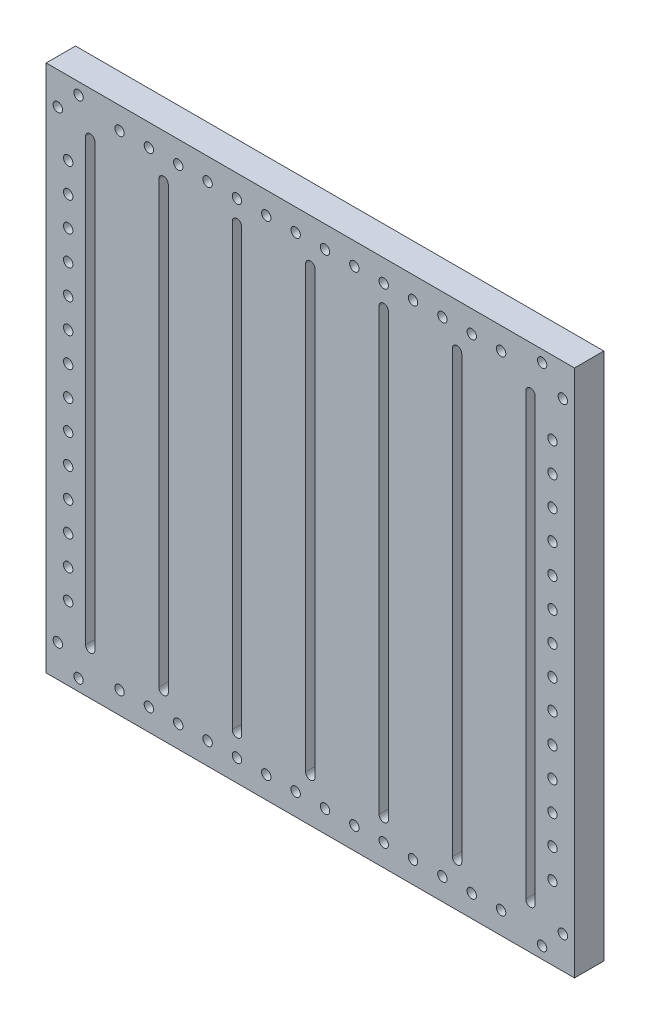
from build123d import *

# Parameters (mm, degrees)
SKETCH1_W           = 180
SKETCH1_H           = 180
SKETCH1_R           = 1.6
BOSS_EXTRUDE1_DEPTH = 10


with BuildPart() as part:
    # Sketch1 → Boss-Extrude1 (new body)
    with BuildSketch(Plane.XY):
        Rectangle(SKETCH1_W, SKETCH1_H)
        with Locations((-78.964466094, 86.035533906)):
            Circle(SKETCH1_R, mode=Mode.SUBTRACT)
        with Locations((-86.035533906, 78.964466094)):
            Circle(SKETCH1_R, mode=Mode.SUBTRACT)
        with Locations((78.964466094, 86.035533906)):
            Circle(SKETCH1_R, mode=Mode.SUBTRACT)
        with Locations((86.035533906, 78.964466094)):
            Circle(SKETCH1_R, mode=Mode.SUBTRACT)
        with Locations((86.035533906, -78.964466094)):
            Circle(SKETCH1_R, mode=Mode.SUBTRACT)
        with Locations((78.964466094, -86.035533906)):
            Circle(SKETCH1_R, mode=Mode.SUBTRACT)
        with Locations((-78.964466094, -86.035533906)):
            Circle(SKETCH1_R, mode=Mode.SUBTRACT)
        with Locations((-86.035533906, -78.964466094)):
            Circle(SKETCH1_R, mode=Mode.SUBTRACT)
        with Locations((-5, 82.5)):
            Circle(SKETCH1_R, mode=Mode.SUBTRACT)
        with Locations((5, 82.5)):
            Circle(SKETCH1_R, mode=Mode.SUBTRACT)
        with Locations((-15, 82.5)):
            Circle(SKETCH1_R, mode=Mode.SUBTRACT)
        with Locations((-25, 82.5)):
            Circle(SKETCH1_R, mode=Mode.SUBTRACT)
        with Locations((-35, 82.5)):
            Circle(SKETCH1_R, mode=Mode.SUBTRACT)
        with Locations((-45, 82.5)):
            Circle(SKETCH1_R, mode=Mode.SUBTRACT)
        with Locations((-55, 82.5)):
            Circle(SKETCH1_R, mode=Mode.SUBTRACT)
        with Locations((-65, 82.5)):
            Circle(SKETCH1_R, mode=Mode.SUBTRACT)
        with Locations((15, 82.5)):
            Circle(SKETCH1_R, mode=Mode.SUBTRACT)
        with Locations((25, 82.5)):
            Circle(SKETCH1_R, mode=Mode.SUBTRACT)
        with Locations((35, 82.5)):
            Circle(SKETCH1_R, mode=Mode.SUBTRACT)
        with Locations((45, 82.5)):
            Circle(SKETCH1_R, mode=Mode.SUBTRACT)
        with Locations((55, 82.5)):
            Circle(SKETCH1_R, mode=Mode.SUBTRACT)
        with Locations((65, 82.5)):
            Circle(SKETCH1_R, mode=Mode.SUBTRACT)
        with Locations((82.5, 65)):
            Circle(SKETCH1_R, mode=Mode.SUBTRACT)
        with Locations((82.5, 55)):
            Circle(SKETCH1_R, mode=Mode.SUBTRACT)
        with Locations((82.5, 45)):
            Circle(SKETCH1_R, mode=Mode.SUBTRACT)
        with Locations((82.5, 35)):
            Circle(SKETCH1_R, mode=Mode.SUBTRACT)
        with Locations((82.5, 25)):
            Circle(SKETCH1_R, mode=Mode.SUBTRACT)
        with Locations((82.5, 15)):
            Circle(SKETCH1_R, mode=Mode.SUBTRACT)
        with Locations((82.5, 5)):
            Circle(SKETCH1_R, mode=Mode.SUBTRACT)
        with Locations((82.5, -5)):
            Circle(SKETCH1_R, mode=Mode.SUBTRACT)
        with Locations((82.5, -15)):
            Circle(SKETCH1_R, mode=Mode.SUBTRACT)
        with Locations((82.5, -25)):
            Circle(SKETCH1_R, mode=Mode.SUBTRACT)
        with Locations((82.5, -35)):
            Circle(SKETCH1_R, mode=Mode.SUBTRACT)
        with Locations((82.5, -45)):
            Circle(SKETCH1_R, mode=Mode.SUBTRACT)
        with Locations((82.5, -55)):
            Circle(SKETCH1_R, mode=Mode.SUBTRACT)
        with Locations((82.5, -65)):
            Circle(SKETCH1_R, mode=Mode.SUBTRACT)
        with Locations((65, -82.5)):
            Circle(SKETCH1_R, mode=Mode.SUBTRACT)
        with Locations((55, -82.5)):
            Circle(SKETCH1_R, mode=Mode.SUBTRACT)
        with Locations((45, -82.5)):
            Circle(SKETCH1_R, mode=Mode.SUBTRACT)
        with Locations((35, -82.5)):
            Circle(SKETCH1_R, mode=Mode.SUBTRACT)
        with Locations((25, -82.5)):
            Circle(SKETCH1_R, mode=Mode.SUBTRACT)
        with Locations((15, -82.5)):
            Circle(SKETCH1_R, mode=Mode.SUBTRACT)
        with Locations((5, -82.5)):
            Circle(SKETCH1_R, mode=Mode.SUBTRACT)
        with Locations((-5, -82.5)):
            Circle(SKETCH1_R, mode=Mode.SUBTRACT)
        with Locations((-15, -82.5)):
            Circle(SKETCH1_R, mode=Mode.SUBTRACT)
        with Locations((-25, -82.5)):
            Circle(SKETCH1_R, mode=Mode.SUBTRACT)
        with Locations((-35, -82.5)):
            Circle(SKETCH1_R, mode=Mode.SUBTRACT)
        with Locations((-45, -82.5)):
            Circle(SKETCH1_R, mode=Mode.SUBTRACT)
        with Locations((-55, -82.5)):
            Circle(SKETCH1_R, mode=Mode.SUBTRACT)
        with Locations((-65, -82.5)):
            Circle(SKETCH1_R, mode=Mode.SUBTRACT)
        with Locations((-82.5, -65)):
            Circle(SKETCH1_R, mode=Mode.SUBTRACT)
        with Locations((-82.5, -55)):
            Circle(SKETCH1_R, mode=Mode.SUBTRACT)
        with Locations((-82.5, -45)):
            Circle(SKETCH1_R, mode=Mode.SUBTRACT)
        with Locations((-82.5, -35)):
            Circle(SKETCH1_R, mode=Mode.SUBTRACT)
        with Locations((-82.5, -25)):
            Circle(SKETCH1_R, mode=Mode.SUBTRACT)
        with Locations((-82.5, -15)):
            Circle(SKETCH1_R, mode=Mode.SUBTRACT)
        with Locations((-82.5, -5)):
            Circle(SKETCH1_R, mode=Mode.SUBTRACT)
        with Locations((-82.5, 5)):
            Circle(SKETCH1_R, mode=Mode.SUBTRACT)
        with Locations((-82.5, 15)):
            Circle(SKETCH1_R, mode=Mode.SUBTRACT)
        with Locations((-82.5, 25)):
            Circle(SKETCH1_R, mode=Mode.SUBTRACT)
        with Locations((-82.5, 35)):
            Circle(SKETCH1_R, mode=Mode.SUBTRACT)
        with Locations((-82.5, 45)):
            Circle(SKETCH1_R, mode=Mode.SUBTRACT)
        with Locations((-82.5, 55)):
            Circle(SKETCH1_R, mode=Mode.SUBTRACT)
        with Locations((-82.5, 65)):
            Circle(SKETCH1_R, mode=Mode.SUBTRACT)
        with BuildLine():
            Line((-1.6, 75), (-1.6, -75))
            ThreePointArc((-1.6, -75), (0, -76.6), (1.6, -75))
            Line((1.6, -75), (1.6, 75))
            ThreePointArc((1.6, 75), (0, 76.6), (-1.6, 75))
        make_face(mode=Mode.SUBTRACT)
        with BuildLine():
            Line((23.4, 75), (23.4, -75))
            ThreePointArc((23.4, -75), (25, -76.6), (26.6, -75))
            Line((26.6, -75), (26.6, 75))
            ThreePointArc((26.6, 75), (25, 76.6), (23.4, 75))
        make_face(mode=Mode.SUBTRACT)
        with BuildLine():
            Line((48.4, 75), (48.4, -75))
            ThreePointArc((48.4, -75), (50, -76.6), (51.6, -75))
            Line((51.6, -75), (51.6, 75))
            ThreePointArc((51.6, 75), (50, 76.6), (48.4, 75))
        make_face(mode=Mode.SUBTRACT)
        with BuildLine():
            Line((73.4, 75), (73.4, -75))
            ThreePointArc((73.4, -75), (75, -76.6), (76.6, -75))
            Line((76.6, -75), (76.6, 75))
            ThreePointArc((76.6, 75), (75, 76.6), (73.4, 75))
        make_face(mode=Mode.SUBTRACT)
        with BuildLine():
            Line((-26.6, 75), (-26.6, -75))
            ThreePointArc((-26.6, -75), (-25, -76.6), (-23.4, -75))
            Line((-23.4, -75), (-23.4, 75))
            ThreePointArc((-23.4, 75), (-25, 76.6), (-26.6, 75))
        make_face(mode=Mode.SUBTRACT)
        with BuildLine():
            Line((-51.6, 75), (-51.6, -75))
            ThreePointArc((-51.6, -75), (-50, -76.6), (-48.4, -75))
            Line((-48.4, -75), (-48.4, 75))
            ThreePointArc((-48.4, 75), (-50, 76.6), (-51.6, 75))
        make_face(mode=Mode.SUBTRACT)
        with BuildLine():
            Line((-76.6, 75), (-76.6, -75))
            ThreePointArc((-76.6, -75), (-75, -76.6), (-73.4, -75))
            Line((-73.4, -75), (-73.4, 75))
            ThreePointArc((-73.4, 75), (-75, 76.6), (-76.6, 75))
        make_face(mode=Mode.SUBTRACT)
    extrude(amount=BOSS_EXTRUDE1_DEPTH)


solid = part.part
